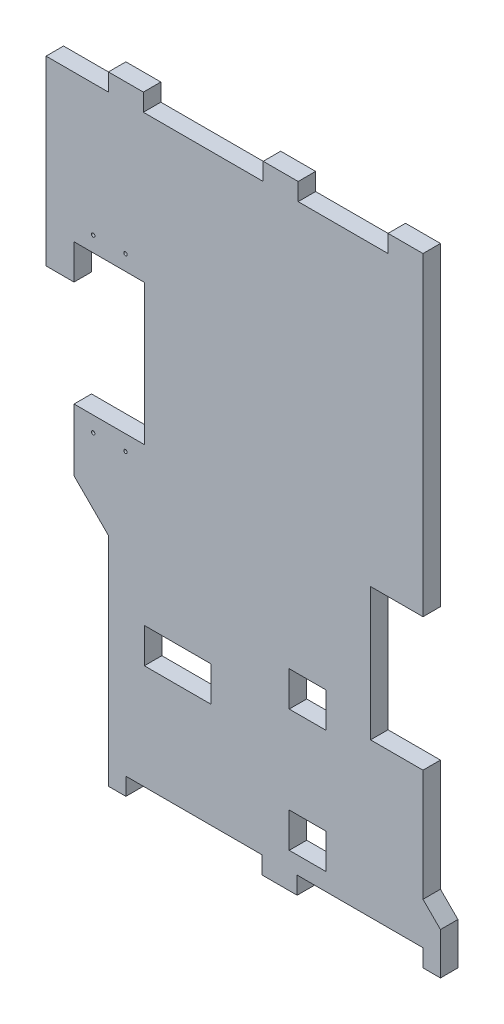
from build123d import *

# Parameters (mm, degrees)
ESQUISSE1_W             = 10.465871206
ESQUISSE1_H             = 10
ESQUISSE1_W_2           = 19.015615649
BOSS_EXTRU_1_DEPTH      = 5
BOSS_EXTRU_2_DEPTH      = 5
ESQUISSE3_R             = 0.5
ESQUISSE3_W             = 20.2
ESQUISSE3_H             = 40.2
ENL_V_MAT_EXTRU_1_DEPTH = 5
ESQUISSE4_W             = 10
ESQUISSE4_H             = 5
BOSS_EXTRU_3_DEPTH      = 5


with BuildPart() as part:
    # Esquisse1 → Boss.-Extru.1 (new body)
    with BuildSketch(Plane.XY):
        Polygon((90, 82), (90, 167), (90, 172), (80, 172), (80, 167), (10, 167), (10, 172), (0, 172), (0, 167), (0, 0), (0, -5), (5, -5), (5, 0), (90, 0), (90, 44), (75, 44), (75, 82), align=None)
        with Locations((56.967345119, 45)):
            Rectangle(ESQUISSE1_W, ESQUISSE1_H, mode=Mode.SUBTRACT)
        with Locations((56.967345119, 10)):
            Rectangle(ESQUISSE1_W, ESQUISSE1_H, mode=Mode.SUBTRACT)
        with Locations((19.799482129, 35)):
            Rectangle(ESQUISSE1_W_2, ESQUISSE1_H, mode=Mode.SUBTRACT)
    extrude(amount=BOSS_EXTRU_1_DEPTH)

    # Esquisse2 → Boss.-Extru.2 (add)
    with BuildSketch(Plane.XY.offset(5)):
        Polygon((0, 167), (-9.834708684, 167), (-9.834708684, 67), (0, 57.165291316), align=None)
    extrude(amount=-BOSS_EXTRU_2_DEPTH)

    # Esquisse3 → Enlèv. mat.-Extru.1 (cut)
    with BuildSketch(Plane(origin=(0, 0, 0), x_dir=(-1, 0, 0), z_dir=(0, 0, -1))):
        with Locations((4.359708684, 129.4)):
            Circle(ESQUISSE3_R)
        with Locations((-4.890291316, 129.4)):
            Circle(ESQUISSE3_R)
        with Locations((4.359708684, 80.4)):
            Circle(ESQUISSE3_R)
        with Locations((-4.890291316, 80.4)):
            Circle(ESQUISSE3_R)
        with Locations((-0.265291316, 104.9)):
            Rectangle(ESQUISSE3_W, ESQUISSE3_H)
    extrude(amount=-ENL_V_MAT_EXTRU_1_DEPTH, mode=Mode.SUBTRACT)

    # Esquisse4 → Boss.-Extru.3 (add)
    with BuildSketch(Plane.XY.offset(5)):
        Polygon((-9.834708684, 167), (-17.834708684, 167), (-17.834708684, 115), (-9.834708684, 115), (-9.834708684, 125), align=None)
        with Locations((49, -2.5)):
            Rectangle(ESQUISSE4_W, ESQUISSE4_H)
        Polygon((90, 12), (95, 7), (95, -5), (90, -5), align=None)
        with Locations((49.28893367, 169.5)):
            Rectangle(ESQUISSE4_W, ESQUISSE4_H)
    extrude(amount=-BOSS_EXTRU_3_DEPTH)


solid = part.part
